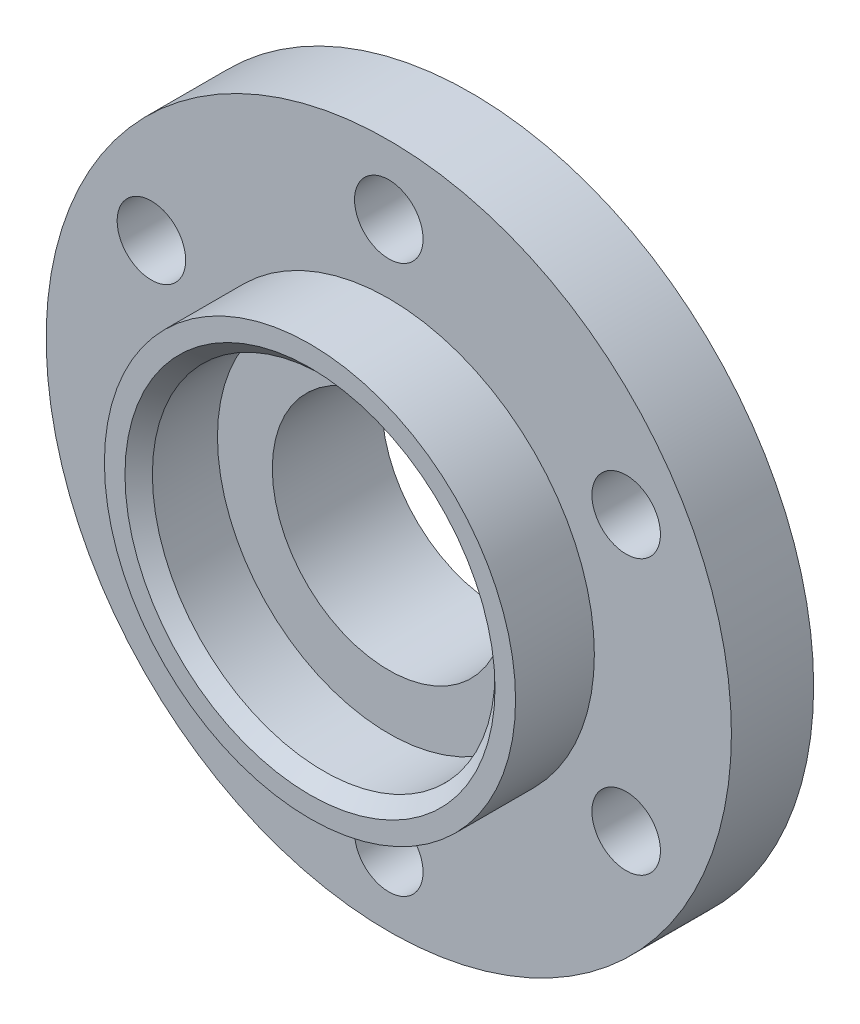
from build123d import *

# Parameters (mm, degrees)
SKETCH1_R                = 25
BOSS_EXTRUDE1_DEPTH      = 6
SKETCH2_R                = 15
SKETCH2_R_2              = 12.5
BOSS_EXTRUDE2_DEPTH      = 5.75
SKETCH3_R                = 14
BOSS_EXTRUDE3_DEPTH      = 2
FILLET1_R                = 2
CHAMFER1_SIZE            = 1
F_5_0_5_DIAMETER_HOLE1_D = 5
CIRPATTERN1_COUNT        = 6
SKETCH10_R               = 8.5
CUT_EXTRUDE1_DEPTH       = 38.934977264


with BuildPart() as part:
    # Sketch1 → Boss-Extrude1 (new body)
    with BuildSketch(Plane.XY):
        Circle(SKETCH1_R)
    extrude(amount=BOSS_EXTRUDE1_DEPTH)

    # Sketch2 → Boss-Extrude2 (add)
    with BuildSketch(Plane.XY.offset(6)):
        Circle(SKETCH2_R)
        Circle(SKETCH2_R_2, mode=Mode.SUBTRACT)
    extrude(amount=BOSS_EXTRUDE2_DEPTH)

    # Sketch3 → Boss-Extrude3 (add)
    with BuildSketch(Plane(origin=(0, 0, 0), x_dir=(-1, 0, 0), z_dir=(0, 0, -1))):
        with Locations(Location((0, 0, 0), (0, 0, 180))):
            Circle(SKETCH3_R)
    extrude(amount=BOSS_EXTRUDE3_DEPTH)

    # Fillet1
    fillet1_edges = [part.edges().sort_by_distance(p)[0] for p in [
        (-14, 0, -2),
    ]]
    fillet(fillet1_edges, radius=FILLET1_R - 0.0001)  # a hair under: the kernel refuses the full size

    # Chamfer1
    chamfer1_edges = [part.edges().sort_by_distance(p)[0] for p in [
        (-12.5, 0, 11.75),
    ]]
    chamfer(chamfer1_edges, length=CHAMFER1_SIZE)

    # Ø5.0 (5) Diameter Hole1 (through all)
    with Locations(Plane(origin=(0, 0, 0), x_dir=(-1, 0, 0), z_dir=(0, 0, -1))):
        with Locations((0, 20)):
            f_5_0_5_diameter_hole1 = Hole(F_5_0_5_DIAMETER_HOLE1_D / 2)

    # CirPattern1: Ø5.0 (5) Diameter Hole1 ×6 about axis
    cirpattern1_axis = Axis((0, 0, 0), (0, 0, 1))
    for i in range(1, CIRPATTERN1_COUNT):
        add(f_5_0_5_diameter_hole1.rotate(cirpattern1_axis, i * 360 / CIRPATTERN1_COUNT), mode=Mode.SUBTRACT)

    # Sketch10 → Cut-Extrude1 (cut, through all)
    with BuildSketch(Plane(origin=(0, 0, -2), x_dir=(-1, 0, 0), z_dir=(0, 0, -1))):
        Circle(SKETCH10_R)
    extrude(amount=-CUT_EXTRUDE1_DEPTH, mode=Mode.SUBTRACT)


solid = part.part
